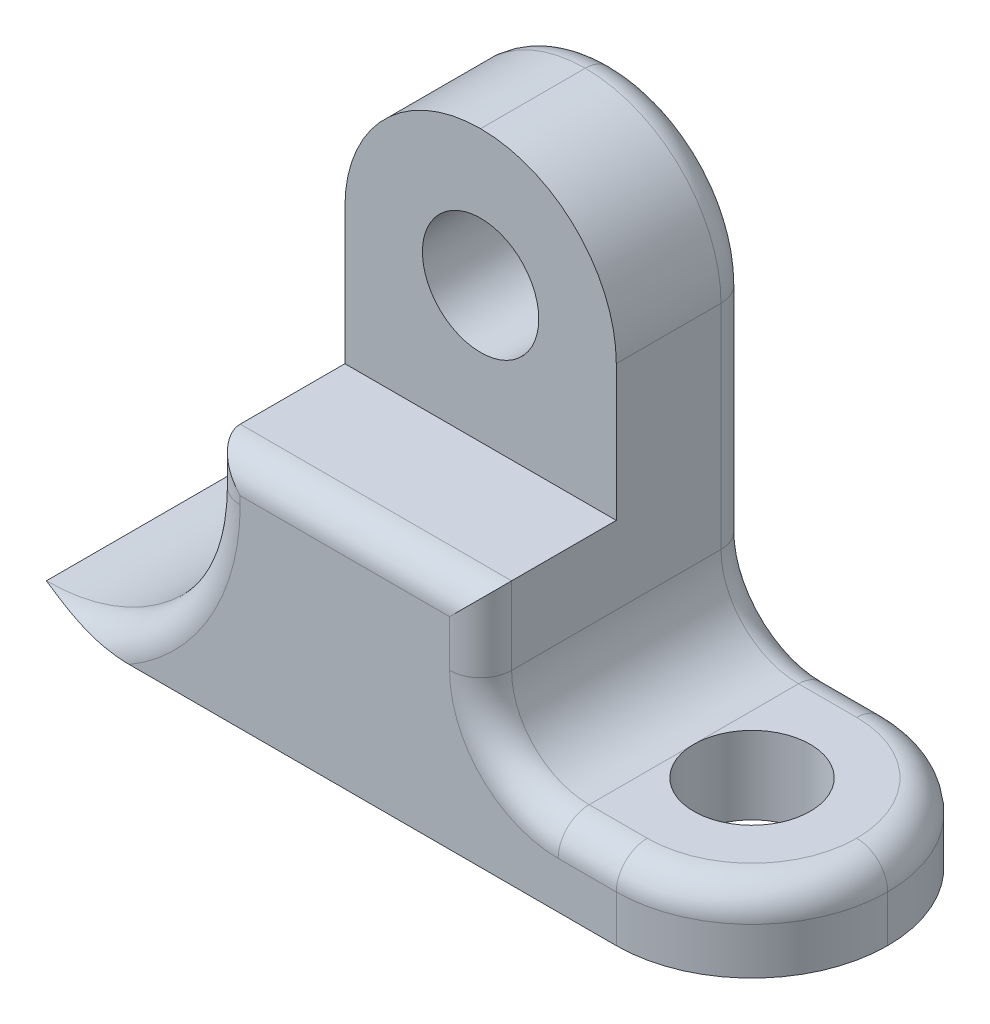
from build123d import *

# Parameters (mm, degrees)
SKETCH_1_W          = 7
SKETCH_1_H          = 13
SKETCH_1_H_2        = 2
EXTRUDE_1_DEPTH     = 7
SKETCH_2_W          = 7
SKETCH_2_H          = 7
CUT_EXTRUDE_1_DEPTH = 3.5
FILLET_1_R          = 3.5
SKETCH_3_R          = 1.5
CUT_EXTRUDE_2_DEPTH = 13.835497653
SKETCH_4_R          = 1.5
CUT_EXTRUDE_3_DEPTH = 17.740669043
FILLET_2_R          = 2
FILLET_3_R          = 0.8


with BuildPart() as part:
    # 草图1 → 凸台-拉伸1 (new body)
    with BuildSketch(Plane.XY):
        with BuildLine():
            Line((-8.5, -6.5), (-3.5, -6.5))
            Line((-3.5, -6.5), (-3.5, -1.5))
            ThreePointArc((-3.5, -1.5), (-4.964466094, -5.035533906), (-8.5, -6.5))
        make_face()
        Rectangle(SKETCH_1_W, SKETCH_1_H)
        with Locations((7, -5.5)):
            Rectangle(SKETCH_1_W, SKETCH_1_H_2)
    extrude(amount=EXTRUDE_1_DEPTH)

    # 草图2 → 切除-拉伸1 (cut)
    with BuildSketch(Plane.XY.offset(7)):
        with Locations((0, 3)):
            Rectangle(SKETCH_2_W, SKETCH_2_H)
    extrude(amount=-CUT_EXTRUDE_1_DEPTH, mode=Mode.SUBTRACT)

    # 圆角1
    fillet_1_edges = [part.edges().sort_by_distance(p)[0] for p in [
        (10.5, -5.5, 0),
        (10.5, -5.5, 7),
        (3.5, 6.5, 1.75),
        (-3.5, 6.5, 1.75),
    ]]
    fillet(fillet_1_edges, radius=FILLET_1_R - 0.0001)  # a hair under: the kernel refuses the full size

    # 草图3 → 切除-拉伸2 (cut, through all)
    with BuildSketch(Plane.XY.offset(3.5)):
        with Locations((0, 3)):
            Circle(SKETCH_3_R)
    extrude(amount=-CUT_EXTRUDE_2_DEPTH, mode=Mode.SUBTRACT)

    # 草图4 → 切除-拉伸3 (cut, through all)
    with BuildSketch(Plane(origin=(0, -4.5, 0), x_dir=(1, 0, 0), z_dir=(0, 1, 0))):
        with Locations(Location((7, -3.5, 0), (0, 0, 180))):
            Circle(SKETCH_4_R)
    extrude(amount=-CUT_EXTRUDE_3_DEPTH, mode=Mode.SUBTRACT)

    # 圆角2
    fillet_2_edges = [part.edges().sort_by_distance(p)[0] for p in [
        (3.5, -4.5, 3.5),
    ]]
    fillet(fillet_2_edges, radius=FILLET_2_R - 0.0001)  # a hair under: the kernel refuses the full size

    # 圆角3
    fillet_3_edges = [part.edges().sort_by_distance(p)[0] for p in [
        (-4.964466094, -5.035533906, 0),
        (3.5, -1.50005, 7),
        (-3.5, -1, 7),
        (0, -0.5, 7),
        (-4.964466094, -5.035533906, 7),
        (6.25, -4.5, 0),
        (6.25, -4.5, 7),
        (9.474903023, -4.5, 5.974903023),
        (9.474903023, -4.5, 1.025096977),
        (-3.5, 0.75005, 0),
        (3.5, 0.25, 0),
        (-2.474903023, 5.474903023, 0),
        (2.474903023, 5.474903023, 0),
        (4.085757148, -3.914242852, 0),
        (4.085757148, -3.914242852, 7),
    ]]
    fillet(fillet_3_edges, radius=FILLET_3_R)


solid = part.part
